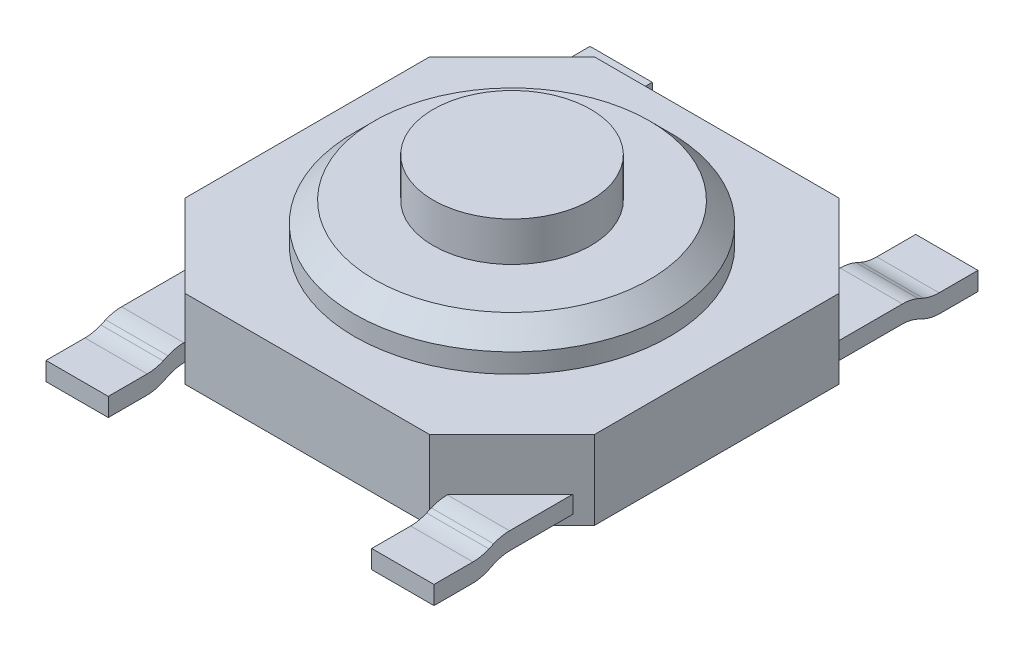
from build123d import *

# Parameters (mm, degrees)
BOSS_EXTRUDE1_DEPTH   = 1
SKETCH4_R             = 2
BOSS_EXTRUDE3_DEPTH   = 0.5
SKETCH2_R             = 1
BOSS_EXTRUDE2_DEPTH   = 0.5
CHAMFER1_SIZE         = 0.254
SKETCH5_W             = 0.790640215
SKETCH5_H             = 0.2205187
BOSS_EXTRUDE4_DEPTH   = 1.644
BOSS_EXTRUDE4_2_DEPTH = 1.644
SKETCH7_W             = 0.790640215
SKETCH7_H             = 0.233563057
BOSS_EXTRUDE5_DEPTH   = 0.6
BOSS_EXTRUDE5_2_DEPTH = 0.6
LOFT1_START           = 1.157491545
LOFT1_DEPTH           = 0.790640215
LOFT2_START           = -2.978578696
LOFT2_DEPTH           = 0.790640215
FILLET1_R             = 0.508


# Read off the part's stored shape, not the designer's step: Loft1, Loft2, Mirror1
with BuildPart() as part:
    # Sketch1 → Boss-Extrude1 (new body)
    with BuildSketch(Plane(origin=(0, 0, 0), x_dir=(1, 0, 0), z_dir=(0, 1, 0))):
        Polygon((-3.115223468, 1.972186251), (-2.070005732, 3.017403987), (1.039558796, 3.017403987), (2.084776532, 1.972186251), (2.084776532, -1.137378277), (1.039558796, -2.182596013), (-2.070005732, -2.182596013), (-3.115223468, -1.137378277), align=None)
    extrude(amount=BOSS_EXTRUDE1_DEPTH)

    # Sketch4 → Boss-Extrude3 (add)
    with BuildSketch(Plane(origin=(0, 1, 0), x_dir=(1, 0, 0), z_dir=(0, 1, 0))):
        with Locations(Location((-0.515223468, 0.417403987, 0), (0, 0, 270))):
            Circle(SKETCH4_R)
    extrude(amount=BOSS_EXTRUDE3_DEPTH)

    # Sketch2 → Boss-Extrude2 (add)
    with BuildSketch(Plane(origin=(0, 1.5, 0), x_dir=(1, 0, 0), z_dir=(0, 1, 0))):
        with Locations(Location((-0.515223468, 0.417403987, 0), (0, 0, 270))):
            Circle(SKETCH2_R)
    extrude(amount=BOSS_EXTRUDE2_DEPTH)

    # Chamfer1
    chamfer1_edges = [part.edges().sort_by_distance(p)[0] for p in [
        (-0.515223468, 1.5, -2.417403987),
    ]]
    chamfer(chamfer1_edges, length=CHAMFER1_SIZE)



with BuildPart() as body_2:
    # Sketch5 → Boss-Extrude4 (new body)
    with BuildSketch(Plane.XY.offset(2.182596013)):
        with Locations((-2.583258589, 0.233563057)):
            Rectangle(SKETCH5_W, SKETCH5_H)
    extrude(amount=-BOSS_EXTRUDE4_DEPTH)



with BuildPart() as body_3:
    # Sketch5 → Boss-Extrude4 2 (new body)
    with BuildSketch(Plane.XY.offset(2.182596013)):
        with Locations((1.552811652, 0.233563057)):
            Rectangle(SKETCH5_W, SKETCH5_H)
    extrude(amount=-BOSS_EXTRUDE4_2_DEPTH)


with BuildPart() as body_4:
    # Sketch7 → Boss-Extrude5 (new body)
    with BuildSketch(Plane.XY.offset(2.436596013)):
        with Locations((-2.583258589, 0.116781529)):
            Rectangle(SKETCH7_W, SKETCH7_H)
    extrude(amount=BOSS_EXTRUDE5_DEPTH)


with BuildPart() as body_5:
    # Sketch7 → Boss-Extrude5 2 (new body)
    with BuildSketch(Plane.XY.offset(2.436596013)):
        with Locations((1.552811652, 0.116781529)):
            Rectangle(SKETCH7_W, SKETCH7_H)
    extrude(amount=BOSS_EXTRUDE5_2_DEPTH)


with BuildPart() as part_1:
    add(part.part)

    add(body_3.part)  # Loft1 merges body 3

    add(body_5.part)  # Loft1 merges body 5
    # Loft1 outline → Loft1 (add)
    with BuildSketch(Plane.YZ.offset(LOFT1_START)):
        Polygon((0.233563057, 2.436596013), (0, 2.436596013), (0.123303707, 2.182596013), (0.343822407, 2.182596013), align=None)
    extrude(amount=LOFT1_DEPTH)


with BuildPart() as body_2_1:
    add(body_2.part)

    add(body_4.part)  # Loft2 merges body 4

    add(part_1.part)  # Loft2 merges part
    # Loft2 outline → Loft2 (add)
    with BuildSketch(Plane.YZ.offset(LOFT2_START)):
        Polygon((0.123303707, 2.182596013), (0.343822407, 2.182596013), (0.233563057, 2.436596013), (0, 2.436596013), align=None)
    extrude(amount=LOFT2_DEPTH)

    # Fillet1
    fillet1_edges = [body_2_1.edges().sort_by_distance(p)[0] for p in [
        (1.552811653, 0.343822407, 2.182596013),
        (-2.583258588, 0.343822407, 2.182596013),
        (-2.583258588, 0, 2.436596013),
        (1.552811653, 0, 2.436596013),
        (-2.583258588, 0.233563057, 2.436596013),
        (1.552811653, 0.233563057, 2.436596013),
        (-2.583258588, 0.123303707, 2.182596013),
        (1.552811653, 0.123303707, 2.182596013),
    ]]
    fillet(fillet1_edges, radius=FILLET1_R)

    # Mirror1: body 2 across plane


with BuildPart() as body_2_2:
    add(body_2_1.part)
    add(body_2_1.part.mirror(Plane.XY.offset(-0.417403987)))


solid = body_2_2.part
